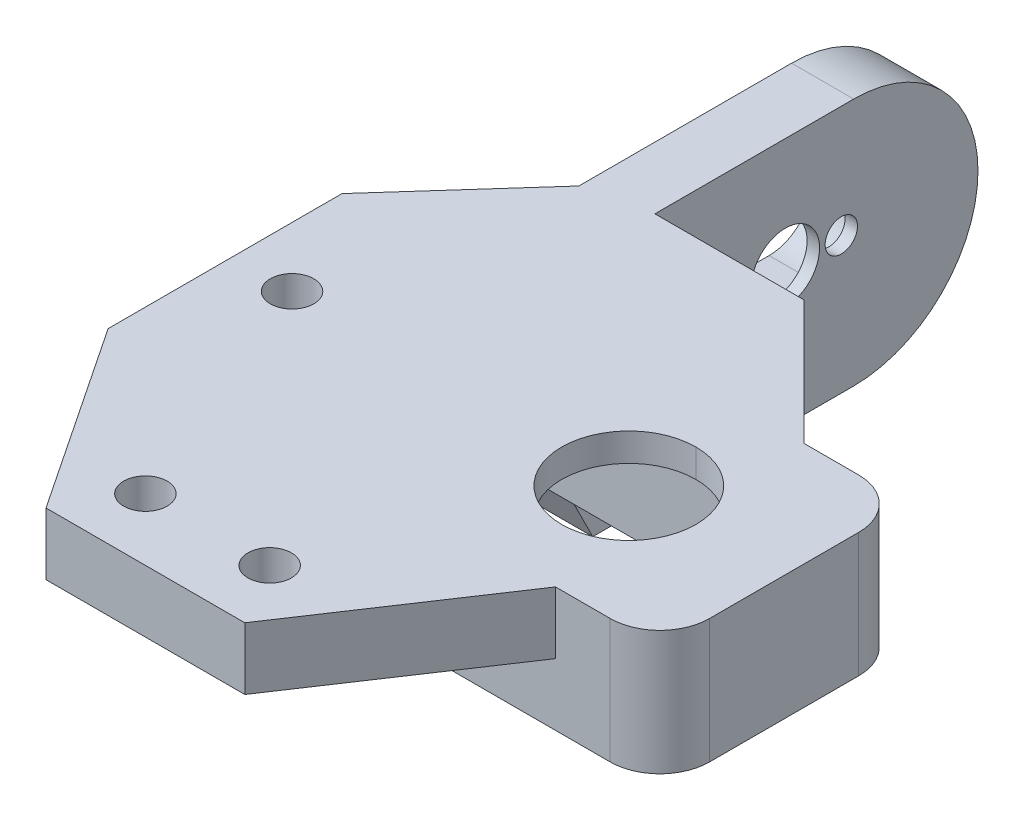
from build123d import *

# Parameters (mm, degrees)
SKETCH1_R                = 1.75
SKETCH1_W                = 7.2
SKETCH1_H                = 5.4
BOSS_EXTRUDE1_DEPTH      = 5
FILLET5_RADIUS           = 10
FILLET5_LENGTH           = 5
FILLET2_R                = 5.4
FILLET6_R                = 5.4
SKETCH3_W                = 35
SKETCH3_H                = 20
SKETCH3_W_2              = 23
SKETCH3_H_2              = 13
BOSS_EXTRUDE4_DEPTH      = 5
SKETCH5_W                = 23
SKETCH5_H                = 13
CUT_EXTRUDE1_DEPTH       = 2.74
CUT_EXTRUDE2_DEPTH       = 76.166481892
FILLET9_R                = 4
BOSS_EXTRUDE7_DEPTH      = 26
BOSS_EXTRUDE7_DEPTH_BACK = 5
SKETCH7_W                = 5
SKETCH7_H                = 20
SKETCH8_R                = 2.75
CUT_EXTRUDE3_DEPTH       = 79.677569866
FILLET10_R               = 10
SKETCH9_R                = 1
CUT_EXTRUDE4_DEPTH       = 7
BOSS_EXTRUDE8_DEPTH      = 5
SKETCH11_R               = 1.3
CUT_EXTRUDE5_DEPTH       = 5
SKETCH12_W               = 14
SKETCH12_H               = 7
CUT_EXTRUDE6_DEPTH       = 4
FILLET11_R               = 3.5


with BuildPart() as part:
    # Sketch1 → Boss-Extrude1 (new body)
    # profile 1 of 4: a face of its own
    with BuildSketch(Plane(origin=(0, 0, 0), x_dir=(1, 0, 0), z_dir=(0, 1, 0))):
        with BuildLine():
            Line((3.05, 25), (0, 25))
            Line((0, 25), (0, 15))
            Line((0, 15), (10, 0))
            Line((10, 0), (26, 0))
            Line((26, 0), (36, 15))
            Line((36, 15), (60, 15))
            Line((60, 15), (60, 25))
            Line((60, 25), (44.5, 25))
            Line((44.5, 25), (44.5, 19.6))
            Line((44.5, 19.6), (37.3, 19.6))
            Line((37.3, 19.6), (26.5, 19.6))
            Line((26.5, 19.6), (26.5, 25))
            Line((26.5, 25), (6.55, 25))
            ThreePointArc((6.55, 25), (4.8, 23.25), (3.05, 25))
        make_face()
        with Locations(Location((13, 5, 0), (0, 0, 270))):
            Circle(SKETCH1_R, mode=Mode.SUBTRACT)
        with Locations(Location((23, 5, 0), (0, 0, 270))):
            Circle(SKETCH1_R, mode=Mode.SUBTRACT)
    # profile 2 of 4: a face of its own
    with BuildSketch(Plane(origin=(0, 0, 0), x_dir=(1, 0, 0), z_dir=(0, 1, 0))):
        with BuildLine():
            Line((10, 45), (0, 33.819660113))
            Line((0, 33.819660113), (0, 25))
            Line((0, 25), (3.05, 25))
            ThreePointArc((3.05, 25), (4.8, 26.75), (6.55, 25))
            Line((6.55, 25), (26.5, 25))
            Line((26.5, 25), (26.5, 30.4))
            Line((26.5, 30.4), (37.3, 30.4))
            Line((37.3, 30.4), (44.5, 30.4))
            Line((44.5, 30.4), (44.5, 25))
            Line((44.5, 25), (60, 25))
            Line((60, 25), (60, 35))
            Line((60, 35), (36, 35))
            Line((36, 35), (26, 45))
            Line((26, 45), (10, 45))
        make_face()
    # profile 3 of 4: a face of its own
    with BuildSketch(Plane(origin=(0, 0, 0), x_dir=(1, 0, 0), z_dir=(0, 1, 0))):
        with Locations((40.9, 27.7)):
            Rectangle(SKETCH1_W, SKETCH1_H)
    # profile 4 of 4: a face of its own
    with BuildSketch(Plane(origin=(0, 0, 0), x_dir=(1, 0, 0), z_dir=(0, 1, 0))):
        with Locations((40.9, 22.3)):
            Rectangle(SKETCH1_W, SKETCH1_H)
    extrude(amount=BOSS_EXTRUDE1_DEPTH)

    # Fillet5: full round fillet: the end face becomes a half cylinder, R = half its width
    fillet5_face = Plane((60, 2.5, -25), x_dir=(0, -1, 0), z_dir=(1, 0, 0))  # on the end face: x along it, z out of the body
    fillet5_slab = fillet5_face.offset(-FILLET5_RADIUS / 2) * Box(FILLET5_LENGTH, 2 * FILLET5_RADIUS, FILLET5_RADIUS, mode=Mode.PRIVATE)  # the body's end, R deep
    fillet5_round = Plane((50, 2.5, -25), x_dir=(1, 0, 0), z_dir=(0, -1, 0)) * Cylinder(FILLET5_RADIUS, FILLET5_LENGTH, mode=Mode.PRIVATE)  # its axis R under the face
    add(fillet5_slab - fillet5_round, mode=Mode.SUBTRACT)

    # Fillet2
    fillet2_edges = [part.edges().sort_by_distance(p)[0] for p in [
        (26.5, 2.5, -30.4),
        (26.5, 2.5, -19.6),
    ]]
    fillet(fillet2_edges, radius=FILLET2_R - 0.0001)  # a hair under: the kernel refuses the full size

    # Fillet6
    fillet6_edges = [part.edges().sort_by_distance(p)[0] for p in [
        (37.3, 2.5, -19.6),
        (37.3, 2.5, -30.4),
    ]]
    fillet(fillet6_edges, radius=FILLET6_R - 0.0001)  # a hair under: the kernel refuses the full size

    # Sketch3 → Boss-Extrude4 (add)
    with BuildSketch(Plane.XZ):
        with Locations((26.9, -25)):
            Rectangle(SKETCH3_W, SKETCH3_H)
        with Locations((26.9, -25)):
            Rectangle(SKETCH3_W_2, SKETCH3_H_2, mode=Mode.SUBTRACT)
    extrude(amount=BOSS_EXTRUDE4_DEPTH)

    # Sketch5 → Cut-Extrude1 (cut)
    with BuildSketch(Plane.XZ):
        with Locations((26.9, -25)):
            Rectangle(SKETCH5_W, SKETCH5_H)
    extrude(amount=-CUT_EXTRUDE1_DEPTH, mode=Mode.SUBTRACT)

    # Sketch6 → Cut-Extrude2 (cut, through all)
    with BuildSketch(Plane.XZ):
        with BuildLine():
            Line((44.4, -35), (50, -35))
            ThreePointArc((50, -35), (60, -25), (50, -15))
            Line((50, -15), (44.4, -15))
            Line((44.4, -15), (44.4, -35))
        make_face()
    extrude(amount=-CUT_EXTRUDE2_DEPTH, mode=Mode.SUBTRACT)

    # Fillet9
    fillet9_edges = [part.edges().sort_by_distance(p)[0] for p in [
        (44.4, 0, -35),
        (44.4, 0, -15),
    ]]
    fillet(fillet9_edges, radius=FILLET9_R)

    # Sketch7 → Boss-Extrude7 (add, two sides: drawn at the far end of the back side and taken through both)
    with BuildSketch(Plane(origin=(0, 0, -45), x_dir=(-1, 0, 0), z_dir=(0, 0, -1)).offset(-BOSS_EXTRUDE7_DEPTH_BACK)):
        with Locations((-11.5, -5)):
            Rectangle(SKETCH7_W, SKETCH7_H)
    extrude(amount=BOSS_EXTRUDE7_DEPTH + BOSS_EXTRUDE7_DEPTH_BACK)

    # Sketch8 → Cut-Extrude3 (cut, through all)
    with BuildSketch(Plane(origin=(14, 0, 0), x_dir=(0, 0, -1), z_dir=(1, 0, 0))):
        with Locations(Location((55.5, -4, 0), (0, 0, 90))):
            Circle(SKETCH8_R)
    extrude(amount=-CUT_EXTRUDE3_DEPTH, mode=Mode.SUBTRACT)

    # Fillet10
    fillet10_edges = [part.edges().sort_by_distance(p)[0] for p in [
        (11.5, -15, -71),
        (11.5, 5, -71),
    ]]
    fillet(fillet10_edges, radius=FILLET10_R - 0.0001)  # a hair under: the kernel refuses the full size

    # Sketch9 → Cut-Extrude4 (cut)
    with BuildSketch(Plane.XZ.offset(5)):
        with Locations(Location((13.1, -25, 0), (0, 0, 270))):
            Circle(SKETCH9_R)
        with Locations(Location((40.7, -25, 0), (0, 0, 270))):
            Circle(SKETCH9_R)
    extrude(amount=-CUT_EXTRUDE4_DEPTH, mode=Mode.SUBTRACT)

    # Sketch10 → Boss-Extrude8 (add)
    with BuildSketch(Plane.ZY.offset(-9)):
        Polygon((-40, 0), (-40, -15), (-35, -5), (-35, 0), align=None)
    extrude(amount=-BOSS_EXTRUDE8_DEPTH)

    # Sketch11 → Cut-Extrude5 (cut)
    with BuildSketch(Plane.ZY.offset(-9)):
        with Locations(Location((-51, -4, 0), (0, 0, 270))):
            Circle(SKETCH11_R)
        with Locations(Location((-60, -4, 0), (0, 0, 270))):
            Circle(SKETCH11_R)
    extrude(amount=-CUT_EXTRUDE5_DEPTH, mode=Mode.SUBTRACT)

    # Sketch12 → Cut-Extrude6 (cut)
    with BuildSketch(Plane.ZY.offset(-9)):
        with Locations((-55.6871773, -4.003401726)):
            Rectangle(SKETCH12_W, SKETCH12_H)
    extrude(amount=-CUT_EXTRUDE6_DEPTH, mode=Mode.SUBTRACT)

    # Fillet11
    fillet11_edges = [part.edges().sort_by_distance(p)[0] for p in [
        (11, -7.503401726, -48.6871773),
        (11, -0.503401726, -48.6871773),
        (11, -0.503401726, -62.6871773),
        (11, -7.503401726, -62.6871773),
    ]]
    fillet(fillet11_edges, radius=FILLET11_R - 0.0001)  # a hair under: the kernel refuses the full size


solid = part.part
